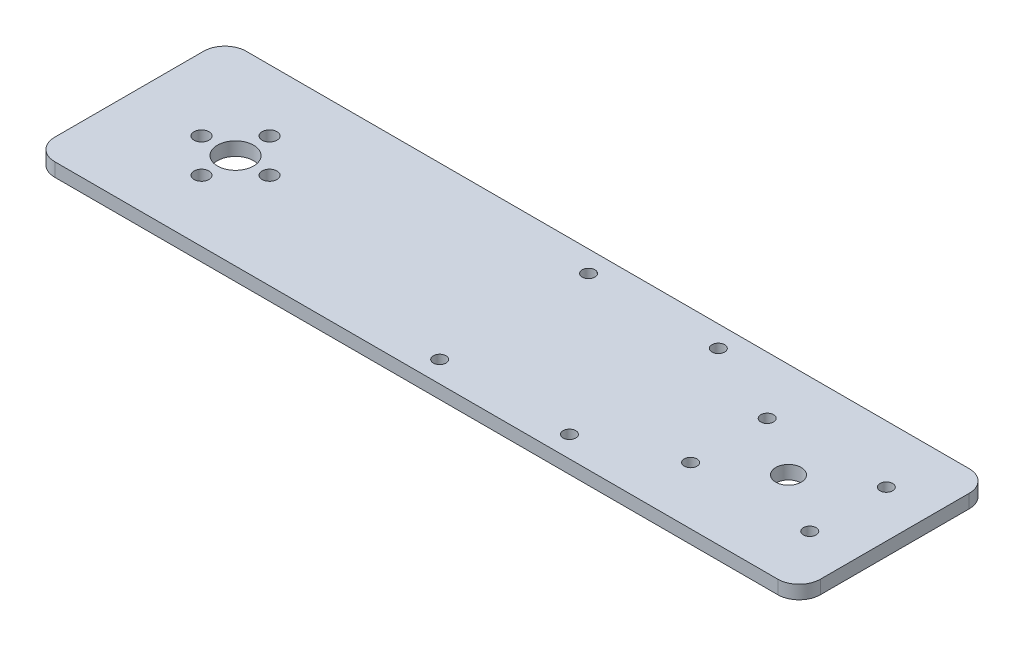
from build123d import *

# Parameters (mm, degrees)
SKETCH1_W           = 180
SKETCH1_H           = 45
BOSS_EXTRUDE1_DEPTH = 3.175
FILLET1_R           = 5
SKETCH4_R           = 3
SKETCH4_R_2         = 1.5
CUT_EXTRUDE1_DEPTH  = 157.65672863
SKETCH5_R           = 4.25
CUT_EXTRUDE2_DEPTH  = 157.65672863
SKETCH10_R          = 1.5
CUT_EXTRUDE4_DEPTH  = 157.65672863
SKETCH11_R          = 1.75
CUT_EXTRUDE5_DEPTH  = 157.65672863


with BuildPart() as part:
    # Sketch1 → Boss-Extrude1 (new body)
    with BuildSketch(Plane(origin=(0, 0, 0), x_dir=(1, 0, 0), z_dir=(0, 1, 0))):
        with Locations((65, 0)):
            Rectangle(SKETCH1_W, SKETCH1_H)
    extrude(amount=BOSS_EXTRUDE1_DEPTH)

    # Fillet1
    fillet1_edges = [part.edges().sort_by_distance(p)[0] for p in [
        (-25, 1.5875, 22.5),
        (-25, 1.5875, -22.5),
        (155, 1.5875, -22.5),
        (155, 1.5875, 22.5),
    ]]
    fillet(fillet1_edges, radius=FILLET1_R)

    # Sketch4 → Cut-Extrude1 (cut, through all)
    with BuildSketch(Plane(origin=(0, 3.175, 0), x_dir=(1, 0, 0), z_dir=(0, 1, 0))):
        with Locations((130, 0)):
            Circle(SKETCH4_R)
        with Locations((116, 9)):
            Circle(SKETCH4_R_2)
        with Locations((144, 9)):
            Circle(SKETCH4_R_2)
        with Locations((144, -9)):
            Circle(SKETCH4_R_2)
        with Locations((116, -9)):
            Circle(SKETCH4_R_2)
    extrude(amount=-CUT_EXTRUDE1_DEPTH, mode=Mode.SUBTRACT)

    # Sketch5 → Cut-Extrude2 (cut, through all)
    with BuildSketch(Plane(origin=(0, 3.175, 0), x_dir=(1, 0, 0), z_dir=(0, 1, 0))):
        Circle(SKETCH5_R)
    extrude(amount=-CUT_EXTRUDE2_DEPTH, mode=Mode.SUBTRACT)

    # Sketch10 → Cut-Extrude4 (cut, through all)
    with BuildSketch(Plane(origin=(0, 3.175, 0), x_dir=(1, 0, 0), z_dir=(0, 1, 0))):
        with Locations((65.5, -17.5)):
            Circle(SKETCH10_R)
        with Locations((96, -17.5)):
            Circle(SKETCH10_R)
        with Locations((96, 17.5)):
            Circle(SKETCH10_R)
        with Locations((65.5, 17.5)):
            Circle(SKETCH10_R)
    extrude(amount=-CUT_EXTRUDE4_DEPTH, mode=Mode.SUBTRACT)

    # Sketch11 → Cut-Extrude5 (cut, through all)
    with BuildSketch(Plane(origin=(0, 3.175, 0), x_dir=(1, 0, 0), z_dir=(0, 1, 0))):
        with Locations((8, 0)):
            Circle(SKETCH11_R)
        with Locations((0, -8)):
            Circle(SKETCH11_R)
        with Locations((-8, 0)):
            Circle(SKETCH11_R)
        with Locations((0, 8)):
            Circle(SKETCH11_R)
    extrude(amount=-CUT_EXTRUDE5_DEPTH, mode=Mode.SUBTRACT)


solid = part.part
